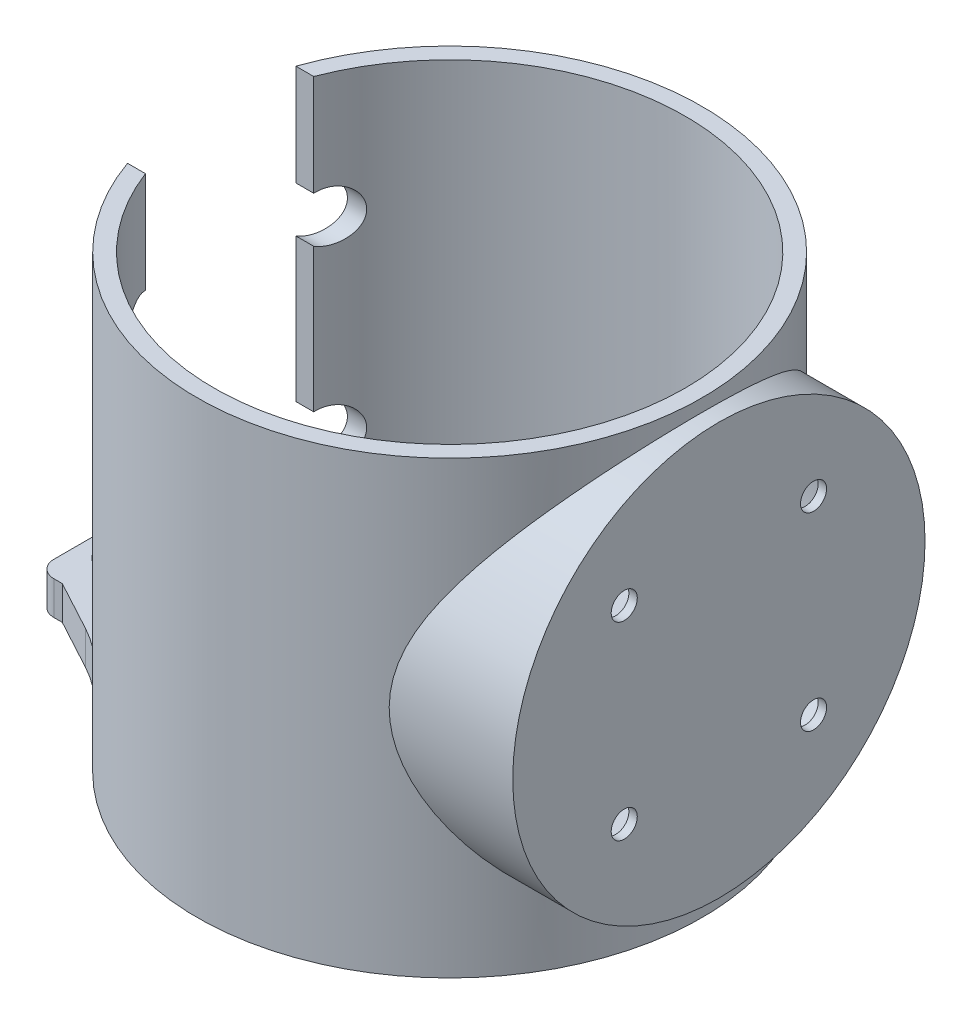
from build123d import *
from build123d.topology import SkipClean

# Parameters (mm, degrees)
SKETCH_1_R                  = 30
EXTRUDE_1_DEPTH             = 3.5
SKETCH_2_R                  = 30
SKETCH_2_R_2                = 28
EXTRUDE_2_DEPTH             = 50
EXTRUDE_8_DEPTH             = 15
SKETCH_4_R                  = 23
CUT_EXTRUDE_1_DEPTH         = 20
CUT_EXTRUDE_START           = -50
SKETCH_5_R                  = 28
CUT_EXTRUDE_2_DEPTH         = 50
SKETCH_6_R                  = 24.5
EXTRUDE_9_DEPTH             = 2
CUT_EXTRUDE_3_DEPTH         = 4
CUT_EXTRUDE_3_DEPTH_BACK    = 67.513156714
SKETCH_8_W                  = 27
SKETCH_8_H                  = 20
SKETCH_8_W_2                = 20
EXTRUDE_START               = -4
EXTRUDE_15_OUTLINE_R        = 2.5
EXTRUDE_15_DEPTH            = 4
SKETCH_9_R                  = 2.15
CUT_EXTRUDE_4_DEPTH         = 73.102820928
CUT_EXTRUDE_5_DEPTH         = 3
PATTERN_LINEAR_1_COUNT      = 2
PATTERN_LINEAR_1_PITCH      = 30
PATTERN_LINEAR_1_COUNT_DIR2 = 2
PATTERN_LINEAR_1_PITCH_DIR2 = 30
SKETCH_11_R                 = 2.5
CUT_EXTRUDE_6_DEPTH         = 70.545429649
CUT_EXTRUDE_7_DEPTH         = 6.5
PATTERN_LINEAR_2_COUNT      = 2
PATTERN_LINEAR_2_PITCH      = 48
PATTERN_LINEAR_2_COUNT_DIR2 = 2
PATTERN_LINEAR_2_PITCH_DIR2 = 10
SKETCH_13_R                 = 1.55
CUT_EXTRUDE_8_DEPTH         = 92.50377519
CUT_EXTRUDE_START_2         = -1
SKETCH_14_R                 = 3
CUT_EXTRUDE_9_DEPTH         = 93.50377519
PATTERN_CIRCULAR_1_COUNT    = 4


with BuildPart() as part:
    # 草图1 → 凸台-拉伸1 (new body)
    with BuildSketch(Plane(origin=(0, 0, 0), x_dir=(1, 0, 0), z_dir=(0, 1, 0))):
        with Locations(Location((0, 0, 0), (0, 0, 270))):
            Circle(SKETCH_1_R)
    extrude(amount=EXTRUDE_1_DEPTH)

    # 草图2 → 凸台-拉伸2 (add)
    with BuildSketch(Plane(origin=(0, 3.5, 0), x_dir=(1, 0, 0), z_dir=(0, 1, 0))):
        with Locations(Location((0, 0, 0), (0, 0, 270))):
            Circle(SKETCH_2_R)
        with Locations(Location((0, 0, 0), (0, 0, 270))):
            Circle(SKETCH_2_R_2, mode=Mode.SUBTRACT)
    extrude(amount=EXTRUDE_2_DEPTH)

    # 草图4 → 切除-拉伸1 (cut)
    with BuildSketch(Plane(origin=(30, 0, 0), x_dir=(0, 0, -1), z_dir=(1, 0, 0))):
        with Locations((0, 27.5)):
            Circle(SKETCH_4_R)
    extrude(amount=-CUT_EXTRUDE_1_DEPTH, mode=Mode.SUBTRACT)


with BuildPart() as body_2:
    # 草图3 → 凸台-拉伸8 (new body)
    with BuildSketch(Plane(origin=(30, 0, 0), x_dir=(0, 0, -1), z_dir=(1, 0, 0))):
        with BuildLine():
            ThreePointArc((0, 52), (-24.5, 27.5), (0, 3))
            Line((0, 3), (0, 4.5))
            ThreePointArc((0, 4.5), (-23, 27.5), (0, 50.5))
            Line((0, 50.5), (0, 52))
        make_face()
        with BuildLine():
            Line((0, 4.5), (0, 3))
            ThreePointArc((0, 3), (17.324116139, 10.175883861), (24.5, 27.5))
            ThreePointArc((24.5, 27.5), (17.324116139, 44.824116139), (0, 52))
            Line((0, 52), (0, 50.5))
            ThreePointArc((0, 50.5), (16.263455967, 43.763455967), (23, 27.5))
            ThreePointArc((23, 27.5), (16.263455967, 11.236544033), (0, 4.5))
        make_face()
    extrude(amount=-EXTRUDE_8_DEPTH)

    # 草图5 → 切除-拉伸2 (cut)
    with BuildSketch(Plane(origin=(0, 53.5, 0), x_dir=(1, 0, 0), z_dir=(0, 1, 0)).offset(CUT_EXTRUDE_START)):
        with Locations(Location((0, 0, 0), (0, 0, 270))):
            Circle(SKETCH_5_R)
    extrude(amount=CUT_EXTRUDE_2_DEPTH, mode=Mode.SUBTRACT)


with BuildPart() as extrude_9_tool:
    # 草图6 → 凸台-拉伸9 (new body)
    with SkipClean():  # the faces are left unmerged after this step: merging them gives an invalid solid
        with BuildSketch(Plane(origin=(30, 0, 0), x_dir=(0, 0, -1), z_dir=(1, 0, 0))):
            with Locations((0, 27.5)):
                Circle(SKETCH_6_R)
        extrude(amount=EXTRUDE_9_DEPTH)


with BuildPart() as part_1:
    with SkipClean():  # the faces are left unmerged after this step: merging them gives an invalid solid
        add(part.part)


with BuildPart() as part_2:
    # 凸台-拉伸9: joined with extrude_9_tool
    with SkipClean():  # the faces are left unmerged after this step: merging them gives an invalid solid
        add(part_1.part.fuse(extrude_9_tool.part, body_2.part, tol=0.00001))

    # 草图8 → 切除-拉伸3 (cut, two sides: drawn at the far end of the back side and taken through both)
    with SkipClean():  # the faces are left unmerged after this step: merging them gives an invalid solid
        with BuildSketch(Plane(origin=(0, 3.5, 0), x_dir=(-1, 0, 0), z_dir=(0, -1, 0)).offset(-CUT_EXTRUDE_3_DEPTH_BACK)):
            with Locations((23.5, 0)):
                Rectangle(SKETCH_8_W, SKETCH_8_H)
            Rectangle(SKETCH_8_W_2, SKETCH_8_H)
        extrude(amount=CUT_EXTRUDE_3_DEPTH + CUT_EXTRUDE_3_DEPTH_BACK, mode=Mode.SUBTRACT)

    # 凸台-拉伸15: read off the stored shape, not the designer's step
    # 凸台-拉伸15 outline → 凸台-拉伸15 (add)
    # profile 1 of 2: a face of its own
    with SkipClean():  # the faces are left unmerged after this step: merging them gives an invalid solid
        with BuildSketch(Plane(origin=(0, 3.5, 0), x_dir=(-1, 0, 0), z_dir=(0, -1, 0)).offset(EXTRUDE_START)):
            with BuildLine():
                Line((30, 10), (30, -10))
                Line((30, -10), (28.284271247, -10))
                ThreePointArc((28.284271247, -10), (26.087911438, -14.812861871), (23.080286113, -19.165082649))
                ThreePointArc((23.080286113, -19.165082649), (25.787653215, -16.474725649), (28.956802834, -14.347674144))
                Line((28.956802834, -14.347674144), (34.902068137, -11.134017223))
                Line((34.902068137, -11.134017223), (35.902068137, -11.134017223))
                ThreePointArc((35.902068137, -11.134017223), (37.316281699, -10.548230785), (37.902068137, -9.134017223))
                Line((37.902068137, -9.134017223), (37.902068137, 9.134017223))
                ThreePointArc((37.902068137, 9.134017223), (37.316281699, 10.548230785), (35.902068137, 11.134017223))
                Line((35.902068137, 11.134017223), (34.902068137, 11.134017223))
                Line((34.902068137, 11.134017223), (28.956802834, 14.347674144))
                ThreePointArc((28.956802834, 14.347674144), (25.787653215, 16.474725649), (23.080286113, 19.165082649))
                ThreePointArc((23.080286113, 19.165082649), (26.087911438, 14.812861871), (28.284271247, 10))
                Line((28.284271247, 10), (30, 10))
            make_face()
            with Locations((34, -5)):
                Circle(EXTRUDE_15_OUTLINE_R, mode=Mode.SUBTRACT)
            with Locations((34, 5)):
                Circle(EXTRUDE_15_OUTLINE_R, mode=Mode.SUBTRACT)
        # profile 2 of 2: a face of its own
        with BuildSketch(Plane(origin=(0, 3.5, 0), x_dir=(-1, 0, 0), z_dir=(0, -1, 0)).offset(EXTRUDE_START)):
            with BuildLine():
                ThreePointArc((-25.592967729, -11.357816815), (0.734463023, -27.990365558), (26.153393661, -10))
                Line((26.153393661, -10), (-10, -10))
                Line((-10, -10), (-10, 10))
                Line((-10, 10), (26.153393661, 10))
                ThreePointArc((26.153393661, 10), (0.734463114, 27.990365555), (-25.592967656, 11.357816981))
                ThreePointArc((-25.592967656, 11.357816981), (-28, 9.1e-08), (-25.592967729, -11.357816815))
            make_face()
            with Locations((-14, -5)):
                Circle(EXTRUDE_15_OUTLINE_R, mode=Mode.SUBTRACT)
            with Locations((-14, 5)):
                Circle(EXTRUDE_15_OUTLINE_R, mode=Mode.SUBTRACT)
        extrude(amount=EXTRUDE_15_DEPTH)

    # 草图9 → 切除-拉伸4 (cut, through all)
    with SkipClean():  # the faces are left unmerged after this step: merging them gives an invalid solid
        with BuildSketch(Plane.XZ):
            with Locations(Location((15, -15, 0), (0, 0, 270))):
                Circle(SKETCH_9_R)
        cut_extrude_4 = extrude(amount=-CUT_EXTRUDE_4_DEPTH, mode=Mode.SUBTRACT)

    # 草图10 → 切除-拉伸5 (cut)
    with SkipClean():  # the faces are left unmerged after this step: merging them gives an invalid solid
        with BuildSketch(Plane(origin=(0, 7.5, 0), x_dir=(1, 0, 0), z_dir=(0, 1, 0))):
            Polygon((10.843078062, 15), (12.921539031, 11.4), (17.078460969, 11.4), (19.156921938, 15), (17.078460969, 18.6), (12.921539031, 18.6), align=None)
        cut_extrude_5 = extrude(amount=-CUT_EXTRUDE_5_DEPTH, mode=Mode.SUBTRACT)

    # 阵列(线性)1: 切除-拉伸4, Cut-Extrude 5 2 × 2
    with SkipClean():  # the faces are left unmerged after this step: merging them gives an invalid solid
        with Locations(*[(-i * PATTERN_LINEAR_1_PITCH, 0, j * PATTERN_LINEAR_1_PITCH_DIR2) for i in range(PATTERN_LINEAR_1_COUNT) for j in range(PATTERN_LINEAR_1_COUNT_DIR2) if (i, j) != (0, 0)]):
            add(cut_extrude_4, mode=Mode.SUBTRACT)
            add(cut_extrude_5, mode=Mode.SUBTRACT)

    # 草图11 → 切除-拉伸6 (cut, through all)
    with SkipClean():  # the faces are left unmerged after this step: merging them gives an invalid solid
        with BuildSketch(Plane(origin=(0, 3.5, 0), x_dir=(1, 0, 0), z_dir=(0, 1, 0))):
            with Locations(Location((14, -5, 0), (0, 0, 90))):
                Circle(SKETCH_11_R)
            with Locations(Location((14, 5, 0), (0, 0, 90))):
                Circle(SKETCH_11_R)
        extrude(amount=-CUT_EXTRUDE_6_DEPTH, mode=Mode.SUBTRACT)

    # 草图12 → 切除-拉伸7 (cut)
    with SkipClean():  # the faces are left unmerged after this step: merging them gives an invalid solid
        with BuildSketch(Plane.XZ):
            Polygon((14, 0.843078062), (17.6, 2.921539031), (17.6, 7.078460969), (14, 9.156921938), (10.4, 7.078460969), (10.4, 2.921539031), align=None)
        cut_extrude_7 = extrude(amount=-CUT_EXTRUDE_7_DEPTH, mode=Mode.SUBTRACT)

    # 阵列(线性)2: Cut-Extrude 7 2 × 2
    with SkipClean():  # the faces are left unmerged after this step: merging them gives an invalid solid
        with Locations(*[(-i * PATTERN_LINEAR_2_PITCH, 0, -j * PATTERN_LINEAR_2_PITCH_DIR2) for i in range(PATTERN_LINEAR_2_COUNT) for j in range(PATTERN_LINEAR_2_COUNT_DIR2) if (i, j) != (0, 0)]):
            add(cut_extrude_7, mode=Mode.SUBTRACT)

    # 草图13 → 切除-拉伸8 (cut, through all)
    with SkipClean():  # the faces are left unmerged after this step: merging them gives an invalid solid
        with BuildSketch(Plane.ZY.offset(-30)):
            with Locations((-11.25, 38.75)):
                Circle(SKETCH_13_R)
        cut_extrude_8 = extrude(amount=-CUT_EXTRUDE_8_DEPTH, mode=Mode.SUBTRACT)

    # 草图14 → 切除-拉伸9 (cut)
    with SkipClean():  # the faces are left unmerged after this step: merging them gives an invalid solid
        with BuildSketch(Plane.ZY.offset(-30).offset(CUT_EXTRUDE_START_2)):
            with Locations(Location((-11.25, 38.75, 0), (0, 0, 180))):
                Circle(SKETCH_14_R)
        cut_extrude_9 = extrude(amount=CUT_EXTRUDE_9_DEPTH, mode=Mode.SUBTRACT)

    # 圆角1: read off the stored shape, not the designer's step
    # 圆角1 outline → 圆角1 (revolve)
    with SkipClean():  # the faces are left unmerged after this step: merging them gives an invalid solid
        with BuildSketch(Plane(origin=(0, 38.75, -11.25), x_dir=(0, 1, 0), z_dir=(0, 0, -1))):
            with BuildLine():
                Line((3, 31), (2, 31))
                ThreePointArc((2, 31), (2.707106781, 30.707106781), (3, 30))
                Line((3, 30), (3, 31))
            make_face()
        fillet_1 = revolve(axis=Axis((0, 38.75, -11.25), (1, 0, 0)))

    # 阵列(圆周)1: 切除-拉伸8, 切除-拉伸9, 圆角1 ×4 about axis
    with SkipClean():  # the faces are left unmerged after this step: merging them gives an invalid solid
        pattern_circular_1_axis = Axis((0, 27.5, 0), (1, 0, 0))
        add([cut_extrude_8.rotate(pattern_circular_1_axis, i * 360 / PATTERN_CIRCULAR_1_COUNT) for i in range(1, PATTERN_CIRCULAR_1_COUNT)], mode=Mode.SUBTRACT)
        add([cut_extrude_9.rotate(pattern_circular_1_axis, i * 360 / PATTERN_CIRCULAR_1_COUNT) for i in range(1, PATTERN_CIRCULAR_1_COUNT)], mode=Mode.SUBTRACT)
        add([fillet_1.rotate(pattern_circular_1_axis, i * 360 / PATTERN_CIRCULAR_1_COUNT) for i in range(1, PATTERN_CIRCULAR_1_COUNT)])


solid = part_2.part
